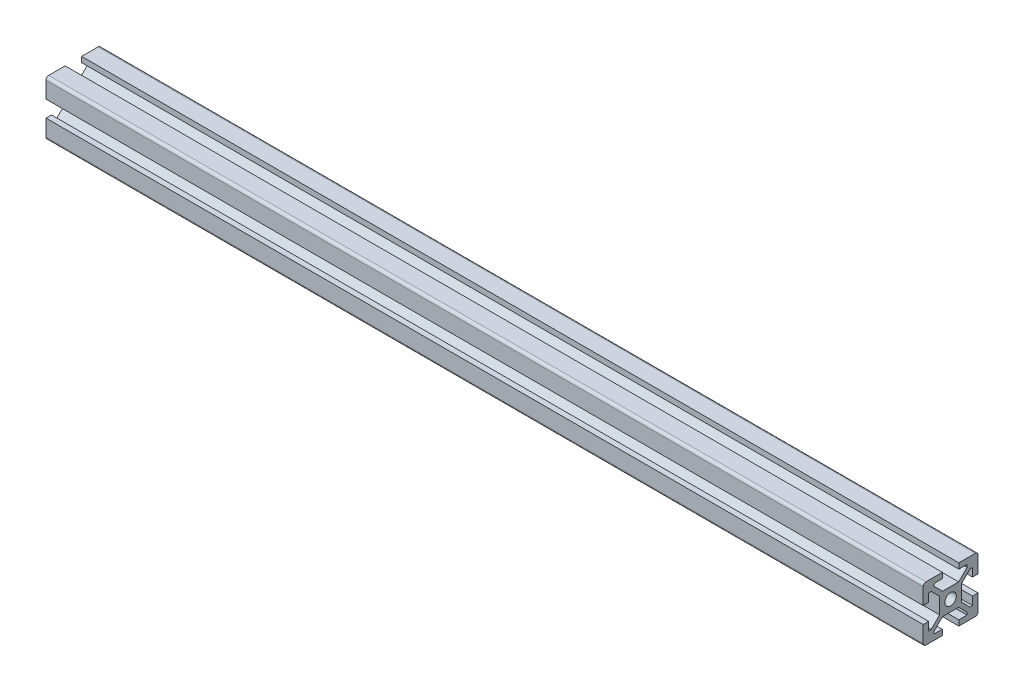
from build123d import *

# Parameters (mm, degrees)
SKETCH1_R           = 2.1
BOSS_EXTRUDE1_DEPTH = 320


with BuildPart() as part:
    # Sketch1 → Boss-Extrude1 (new body)
    with BuildSketch(Plane(origin=(0, 0, 0), x_dir=(0, 0, -1), z_dir=(1, 0, 0))):
        with BuildLine():
            Line((-10, 9), (-10, 3))
            Line((-10, 3), (-8, 3))
            Line((-8, 3), (-8, 6))
            Line((-8, 6), (-7.060660172, 6))
            Line((-7.060660172, 6), (-4, 2.939339828))
            Line((-4, 2.939339828), (-4, -2.939339828))
            Line((-4, -2.939339828), (-7.060660172, -6))
            Line((-7.060660172, -6), (-8, -6))
            Line((-8, -6), (-8, -3))
            Line((-8, -3), (-10, -3))
            Line((-10, -3), (-10, -9))
            ThreePointArc((-10, -9), (-9.707106781, -9.707106781), (-9, -10))
            Line((-9, -10), (-3, -10))
            Line((-3, -10), (-3, -8))
            Line((-3, -8), (-6, -8))
            Line((-6, -8), (-6, -7.060660172))
            Line((-6, -7.060660172), (-2.939339828, -4))
            Line((-2.939339828, -4), (2.939339828, -4))
            Line((2.939339828, -4), (6, -7.060660172))
            Line((6, -7.060660172), (6, -8))
            Line((6, -8), (3, -8))
            Line((3, -8), (3, -10))
            Line((3, -10), (9, -10))
            ThreePointArc((9, -10), (9.707106781, -9.707106781), (10, -9))
            Line((10, -9), (10, -3))
            Line((10, -3), (8, -3))
            Line((8, -3), (8, -6))
            Line((8, -6), (7.060660172, -6))
            Line((7.060660172, -6), (4, -2.939339828))
            Line((4, -2.939339828), (4, 2.939339828))
            Line((4, 2.939339828), (7.060660172, 6))
            Line((7.060660172, 6), (8, 6))
            Line((8, 6), (8, 3))
            Line((8, 3), (10, 3))
            Line((10, 3), (10, 9))
            ThreePointArc((10, 9), (9.707106781, 9.707106781), (9, 10))
            Line((9, 10), (3, 10))
            Line((3, 10), (3, 8))
            Line((3, 8), (6, 8))
            Line((6, 8), (6, 7.060660172))
            Line((6, 7.060660172), (2.939339828, 4))
            Line((2.939339828, 4), (-2.939339828, 4))
            Line((-2.939339828, 4), (-6, 7.060660172))
            Line((-6, 7.060660172), (-6, 8))
            Line((-6, 8), (-3, 8))
            Line((-3, 8), (-3, 10))
            Line((-3, 10), (-9, 10))
            ThreePointArc((-9, 10), (-9.707106781, 9.707106781), (-10, 9))
        make_face()
        Circle(SKETCH1_R, mode=Mode.SUBTRACT)
    extrude(amount=BOSS_EXTRUDE1_DEPTH)


solid = part.part
